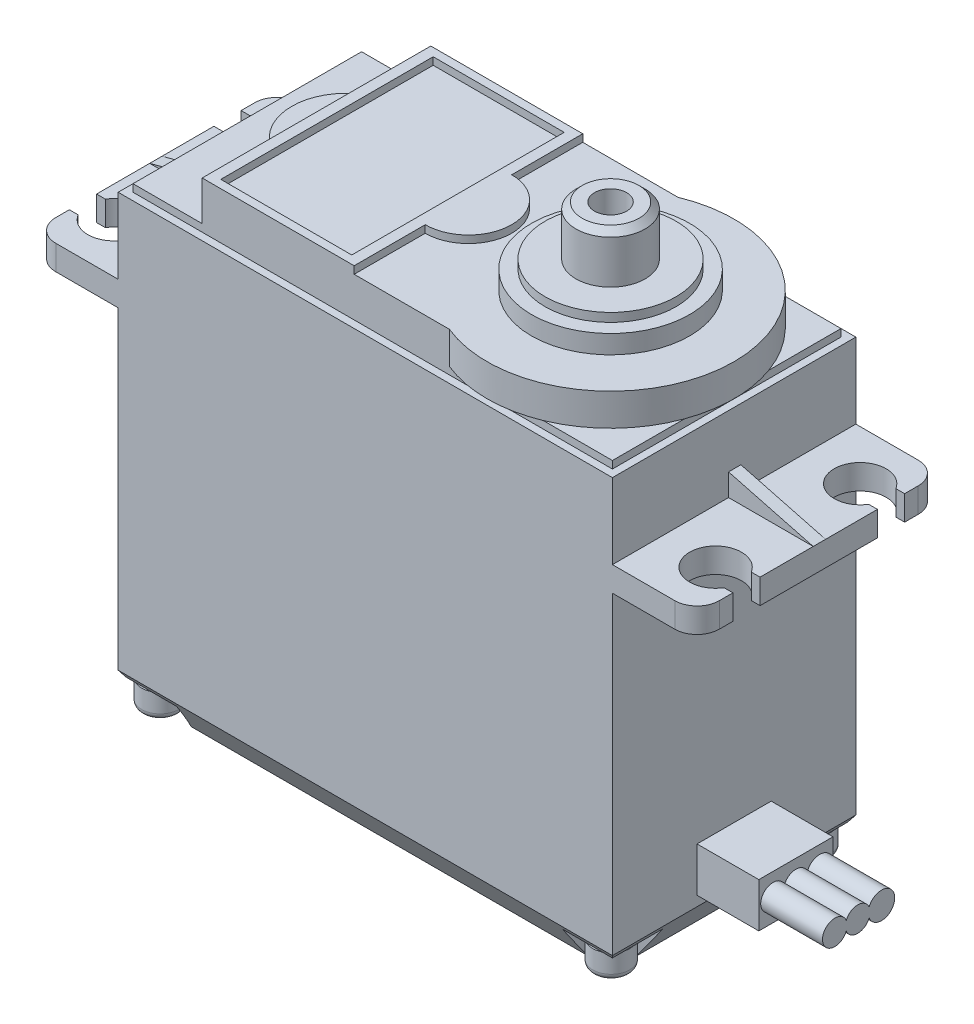
from build123d import *

# Parameters (mm, degrees)
SKETCH1_W            = 40
SKETCH1_H            = 36.5
BOSS_EXTRUDE1_DEPTH  = 19.7
CHAMFER1_SIZE        = 2
CHAMFER1_SIZE2       = 3
CUT_EXTRUDE1_DEPTH   = 2.5
SKETCH4_R            = 1.5
BOSS_EXTRUDE2_DEPTH  = 2
FILLET1_R            = 0.5
FILLET3_R            = 0.5
FILLET4_R            = 0.5
FILLET5_R            = 0.5
SKETCH5_W            = 53.7
SKETCH5_H            = 19.7
BOSS_EXTRUDE3_DEPTH  = 2
CUT_EXTRUDE2_DEPTH   = 2
FILLET9_R            = 1.8
BOSS_EXTRUDE4_DEPTH  = 1
SKETCH8_W            = 38.8
SKETCH8_H            = 18.5
BOSS_EXTRUDE5_DEPTH  = 0.6
BOSS_EXTRUDE6_DEPTH  = 2.6
SKETCH10_W           = 10.6
SKETCH10_H           = 17.190691902
BOSS_EXTRUDE7_DEPTH  = 0.6
SKETCH11_R           = 6.4
BOSS_EXTRUDE8_DEPTH  = 1.5
SKETCH12_R           = 5.3
BOSS_EXTRUDE9_DEPTH  = 0.7
SKETCH13_R           = 2.8
SKETCH13_R_2         = 1.3
BOSS_EXTRUDE10_DEPTH = 4
CHAMFER2_SIZE        = 0.5
CUT_EXTRUDE3_DEPTH   = 1.2
LPATTERN1_COUNT      = 2
LPATTERN1_PITCH      = 36.5
LPATTERN1_COUNT_DIR2 = 2
LPATTERN1_PITCH_DIR2 = 16.3
SKETCH16_W           = 6
SKETCH16_H           = 3.6
BOSS_EXTRUDE11_DEPTH = 5
BOSS_EXTRUDE16_DEPTH = 5
BOSS_EXTRUDE42_DEPTH = 5


with BuildPart() as part:
    # Sketch1 → Boss-Extrude1 (new body)
    with BuildSketch(Plane.XY):
        Rectangle(SKETCH1_W, SKETCH1_H)
    extrude(amount=BOSS_EXTRUDE1_DEPTH)

    # Chamfer1
    chamfer1_edges = [part.edges().sort_by_distance(p)[0] for p in [
        (0, -18.25, 0),
        (-20, -18.25, 9.85),
        (0, -18.25, 19.7),
        (20, -18.25, 9.85),
    ]]
    chamfer1_side = [part.faces().sort_by_distance(p)[0] for p in [
        (0, -18.25, 9.85),
    ]]
    chamfer(chamfer1_edges, length=CHAMFER1_SIZE, length2=CHAMFER1_SIZE2, reference=chamfer1_side[0])

    # Sketch2 → Cut-Extrude1 (cut)
    with BuildSketch(Plane.XZ.offset(18.25)):
        with BuildLine():
            Line((20, 15.3), (20, 19.7))
            Line((20, 19.7), (15.6, 19.7))
            ThreePointArc((15.6, 19.7), (16.888730163, 16.588730163), (20, 15.3))
        make_face()
        with BuildLine():
            Line((20, 4.4), (20, 0))
            Line((20, 0), (15.6, 0))
            ThreePointArc((15.6, 0), (16.888730163, 3.111269837), (20, 4.4))
        make_face()
        with BuildLine():
            Line((-15.6, 0), (-20, 0))
            Line((-20, 0), (-20, 4.4))
            ThreePointArc((-20, 4.4), (-16.888730163, 3.111269837), (-15.6, 0))
        make_face()
        with BuildLine():
            Line((-20, 15.3), (-20, 19.7))
            Line((-20, 19.7), (-15.6, 19.7))
            ThreePointArc((-15.6, 19.7), (-16.888730163, 16.588730163), (-20, 15.3))
        make_face()
    extrude(amount=-CUT_EXTRUDE1_DEPTH, mode=Mode.SUBTRACT)

    # Sketch4 → Boss-Extrude2 (add)
    with BuildSketch(Plane.XZ.offset(15.75)):
        with Locations((-18.29495858, 18.001219169)):
            Circle(SKETCH4_R)
        with Locations((18.20504142, 18.001219169)):
            Circle(SKETCH4_R)
        with Locations((18.20504142, 1.751219169)):
            Circle(SKETCH4_R)
        with Locations((-18.29495858, 1.751219169)):
            Circle(SKETCH4_R)
    extrude(amount=BOSS_EXTRUDE2_DEPTH)

    # Fillet1
    fillet1_edges = [part.edges().sort_by_distance(p)[0] for p in [
        (-19.79495858, -17.75, 18.001219169),
    ]]
    fillet(fillet1_edges, radius=FILLET1_R)

    # Fillet3
    fillet3_edges = [part.edges().sort_by_distance(p)[0] for p in [
        (-19.79495858, -17.75, 1.751219169),
    ]]
    fillet(fillet3_edges, radius=FILLET3_R)

    # Fillet4
    fillet4_edges = [part.edges().sort_by_distance(p)[0] for p in [
        (16.70504142, -17.75, 1.751219169),
    ]]
    fillet(fillet4_edges, radius=FILLET4_R)

    # Fillet5
    fillet5_edges = [part.edges().sort_by_distance(p)[0] for p in [
        (16.70504142, -17.75, 18.001219169),
    ]]
    fillet(fillet5_edges, radius=FILLET5_R)

    # Sketch5 → Boss-Extrude3 (add)
    with BuildSketch(Plane(origin=(0, 10.15, 0), x_dir=(-1, 0, 0), z_dir=(0, -1, 0))):
        with Locations((0, -9.85)):
            Rectangle(SKETCH5_W, SKETCH5_H)
    extrude(amount=-BOSS_EXTRUDE3_DEPTH)

    # Sketch6 → Cut-Extrude2 (cut)
    with BuildSketch(Plane.XZ.offset(-10.15)):
        with BuildLine():
            Line((26.85, 14.6), (26.138854382, 14.6))
            ThreePointArc((26.138854382, 14.6), (22.25, 15.7), (26.138854382, 16.8))
            Line((26.138854382, 16.8), (26.85, 16.8))
            Line((26.85, 16.8), (26.85, 14.6))
        make_face()
        with BuildLine():
            Line((26.85, 2.9), (26.138854382, 2.9))
            ThreePointArc((26.138854382, 2.9), (22.25, 4), (26.138854382, 5.1))
            Line((26.138854382, 5.1), (26.85, 5.1))
            Line((26.85, 5.1), (26.85, 2.9))
        make_face()
        with BuildLine():
            Line((-26.85, 5.1), (-26.138854382, 5.1))
            ThreePointArc((-26.138854382, 5.1), (-22.25, 4), (-26.138854382, 2.9))
            Line((-26.138854382, 2.9), (-26.85, 2.9))
            Line((-26.85, 2.9), (-26.85, 5.1))
        make_face()
        with BuildLine():
            Line((-26.85, 16.8), (-26.138854382, 16.8))
            ThreePointArc((-26.138854382, 16.8), (-22.25, 15.7), (-26.138854382, 14.6))
            Line((-26.138854382, 14.6), (-26.85, 14.6))
            Line((-26.85, 14.6), (-26.85, 16.8))
        make_face()
    extrude(amount=-CUT_EXTRUDE2_DEPTH, mode=Mode.SUBTRACT)

    # Fillet9
    fillet9_edges = [part.edges().sort_by_distance(p)[0] for p in [
        (26.85, 11.15, 0),
        (-26.85, 11.15, 0),
        (-26.85, 11.15, 19.7),
        (26.85, 11.15, 19.7),
    ]]
    fillet(fillet9_edges, radius=FILLET9_R)

    # Sketch7 → Boss-Extrude4 (add)
    with BuildSketch(Plane.XY.offset(10.3)):
        Polygon((-26.85, 12.15), (-20, 13.95), (-20, 12.15), align=None)
        Polygon((20, 12.15), (20, 13.95), (26.85, 12.15), align=None)
    extrude(amount=-BOSS_EXTRUDE4_DEPTH)

    # Sketch8 → Boss-Extrude5 (add)
    with BuildSketch(Plane(origin=(0, 18.25, 0), x_dir=(1, 0, 0), z_dir=(0, 1, 0))):
        with Locations((0, -9.85)):
            Rectangle(SKETCH8_W, SKETCH8_H)
    extrude(amount=BOSS_EXTRUDE5_DEPTH)

    # Sketch9 → Boss-Extrude6 (add)
    with BuildSketch(Plane(origin=(0, 18.85, 0), x_dir=(1, 0, 0), z_dir=(0, 1, 0))):
        with BuildLine():
            Line((-13.799671038, -6.162182217), (-13.799671038, -0.6))
            Line((-13.799671038, -0.6), (6.200328962, -0.6))
            ThreePointArc((6.200328962, -0.6), (20, -9.85), (6.200328962, -19.1))
            Line((6.200328962, -19.1), (-13.799671038, -19.1))
            Line((-13.799671038, -19.1), (-13.799671038, -13.537817783))
            ThreePointArc((-13.799671038, -13.537817783), (-15.799671038, -9.85), (-13.799671038, -6.162182217))
        make_face()
    extrude(amount=BOSS_EXTRUDE6_DEPTH)

    # Sketch10 → Boss-Extrude7 (add)
    with BuildSketch(Plane(origin=(0, 21.45, 0), x_dir=(1, 0, 0), z_dir=(0, 1, 0))):
        with BuildLine():
            Line((-13.799671038, -19.1), (-13.799671038, -0.6))
            Line((-13.799671038, -0.6), (-1.499671038, -0.6))
            Line((-1.499671038, -0.6), (-1.499671038, -6.35))
            ThreePointArc((-1.499671038, -6.35), (2.000328962, -9.85), (-1.499671038, -13.35))
            Line((-1.499671038, -13.35), (-1.499671038, -19.1))
            Line((-1.499671038, -19.1), (-13.799671038, -19.1))
        make_face()
        with Locations((-7.649671038, -9.85)):
            Rectangle(SKETCH10_W, SKETCH10_H, mode=Mode.SUBTRACT)
    extrude(amount=BOSS_EXTRUDE7_DEPTH)

    # Sketch11 → Boss-Extrude8 (add)
    with BuildSketch(Plane(origin=(0, 21.45, 0), x_dir=(1, 0, 0), z_dir=(0, 1, 0))):
        with Locations((10, -9.85)):
            Circle(SKETCH11_R)
    extrude(amount=BOSS_EXTRUDE8_DEPTH)

    # Sketch12 → Boss-Extrude9 (add)
    with BuildSketch(Plane(origin=(0, 22.95, 0), x_dir=(1, 0, 0), z_dir=(0, 1, 0))):
        with Locations((10, -9.85)):
            Circle(SKETCH12_R)
    extrude(amount=BOSS_EXTRUDE9_DEPTH)

    # Sketch13 → Boss-Extrude10 (add)
    with BuildSketch(Plane(origin=(0, 23.65, 0), x_dir=(1, 0, 0), z_dir=(0, 1, 0))):
        with Locations((10, -9.85)):
            Circle(SKETCH13_R)
        with Locations((10, -9.85)):
            Circle(SKETCH13_R_2, mode=Mode.SUBTRACT)
    extrude(amount=BOSS_EXTRUDE10_DEPTH)

    # Chamfer2
    chamfer2_edges = [part.edges().sort_by_distance(p)[0] for p in [
        (7.2, 27.65, 9.85),
    ]]
    chamfer(chamfer2_edges, length=CHAMFER2_SIZE)

    # Sketch15 → Cut-Extrude3 (cut)
    with BuildSketch(Plane.XZ.offset(17.75)):
        Polygon((18.05504142, 1.601219169), (18.05504142, 0.901219169), (18.35504142, 0.901219169), (18.35504142, 1.601219169), (19.05504142, 1.601219169), (19.05504142, 1.901219169), (18.35504142, 1.901219169), (18.35504142, 2.601219169), (18.05504142, 2.601219169), (18.05504142, 1.901219169), (17.35504142, 1.901219169), (17.35504142, 1.601219169), align=None)
    cut_extrude3 = extrude(amount=-CUT_EXTRUDE3_DEPTH, mode=Mode.SUBTRACT)

    # LPattern1: Cut-Extrude3 2 × 2
    with Locations(*[(-i * LPATTERN1_PITCH, 0, j * LPATTERN1_PITCH_DIR2) for i in range(LPATTERN1_COUNT) for j in range(LPATTERN1_COUNT_DIR2) if (i, j) != (0, 0)]):
        add(cut_extrude3, mode=Mode.SUBTRACT)

    # Sketch16 → Boss-Extrude11 (add)
    with BuildSketch(Plane(origin=(20, 0, 0), x_dir=(0, 0, -1), z_dir=(1, 0, 0))):
        with Locations((-9.85, -12.65)):
            Rectangle(SKETCH16_W, SKETCH16_H)
    extrude(amount=BOSS_EXTRUDE11_DEPTH)

    # Sketch17 → Boss-Extrude16 (add)
    with BuildSketch(Plane(origin=(25, 0, 0), x_dir=(0, 0, -1), z_dir=(1, 0, 0))):
        with BuildLine():
            ThreePointArc((-10.775, -13.00161488), (-9.85, -13.621647776), (-8.925, -13.00161488))
            ThreePointArc((-8.925, -13.00161488), (-6.85, -12.621647776), (-8.925, -12.241680672))
            ThreePointArc((-8.925, -12.241680672), (-9.85, -11.621647776), (-10.775, -12.241680672))
            ThreePointArc((-10.775, -12.241680672), (-12.7, -12.621647776), (-10.775, -13.00161488))
        make_face()
    extrude(amount=BOSS_EXTRUDE16_DEPTH)

    # Sketch17<9> → Boss-Extrude42 (add)
    with BuildSketch(Plane(origin=(25, 0, 0), x_dir=(0, 0, -1), z_dir=(1, 0, 0))):
        with BuildLine():
            ThreePointArc((-10.775, -13.00161488), (-9.85, -13.621647776), (-8.925, -13.00161488))
            ThreePointArc((-8.925, -13.00161488), (-6.85, -12.621647776), (-8.925, -12.241680672))
            ThreePointArc((-8.925, -12.241680672), (-9.85, -11.621647776), (-10.775, -12.241680672))
            ThreePointArc((-10.775, -12.241680672), (-12.7, -12.621647776), (-10.775, -13.00161488))
        make_face()
    extrude(amount=BOSS_EXTRUDE42_DEPTH)


solid = part.part
